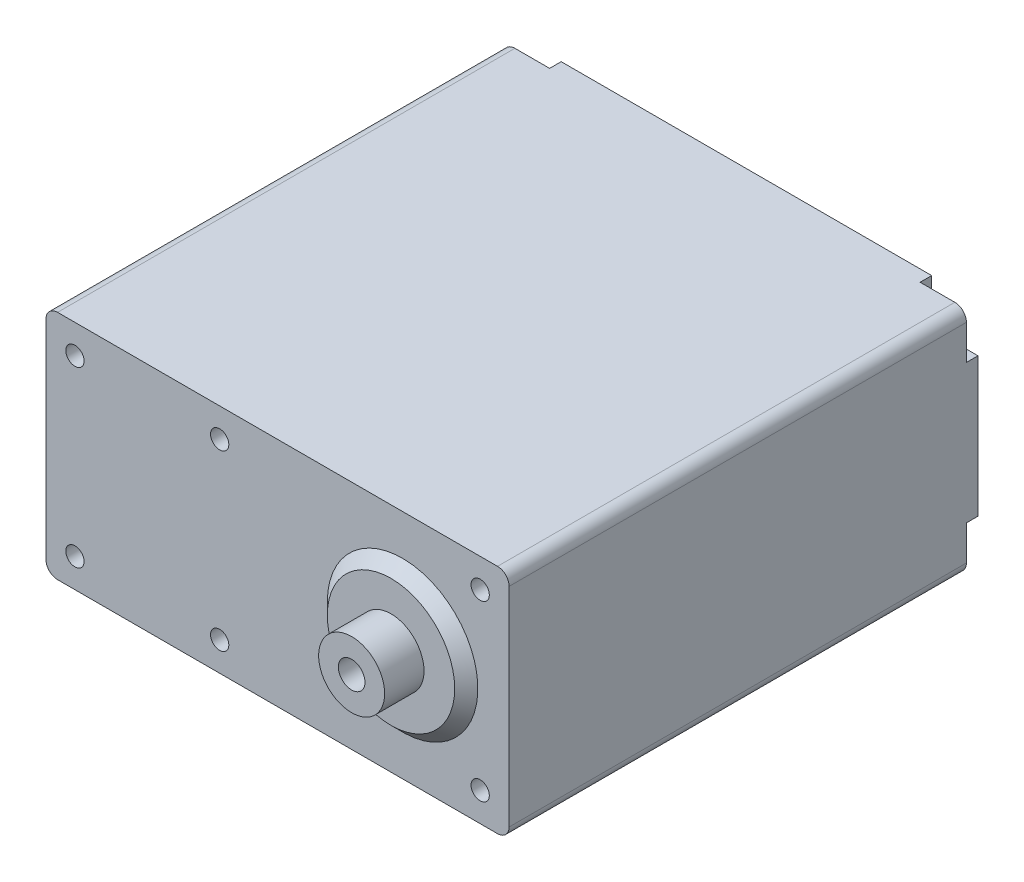
from build123d import *

# Parameters (mm, degrees)
ESQUISSE1_W             = 40
ESQUISSE1_H             = 20
BOSS_EXTRU_1_DEPTH      = 40.5
ESQUISSE2_R             = 0.79
ENL_V_MAT_EXTRU_2_DEPTH = 61.334484335
ENL_V_MAT_EXTRU_3_DEPTH = 1
ESQUISSE4_R             = 0.79
ENL_V_MAT_EXTRU_4_DEPTH = 20
ESQUISSE5_R             = 6.5
BOSS_EXTRU_2_DEPTH      = 1
CHANFREIN1_SIZE         = 1
ESQUISSE6_R             = 2.85
BOSS_EXTRU_3_DEPTH      = 3.4
CONG_1_R                = 1
BOSS_EXTRU_4_START      = 1
ESQUISSE7_R             = 6.5
BOSS_EXTRU_4_DEPTH      = 1
CHANFREIN2_SIZE         = 1
BOSS_EXTRU_5_START      = 3.4
ESQUISSE8_R             = 2.85
BOSS_EXTRU_5_DEPTH      = 3.4
ENL_V_MAT_EXTRU_6_DEPTH = 15
ESQUISSE10_R            = 0.79
ENL_V_MAT_EXTRU_7_DEPTH = 20
ESQUISSE11_R            = 1.15
ENL_V_MAT_EXTRU_8_DEPTH = 15
ENL_V_START             = -15
ESQUISSE12_R            = 1.15
ENL_V_MAT_EXTRU_9_DEPTH = 15


with BuildPart() as part:
    # Esquisse1 → Boss.-Extru.1 (new body)
    with BuildSketch(Plane.XY):
        with Locations((20, 10)):
            Rectangle(ESQUISSE1_W, ESQUISSE1_H)
    extrude(amount=BOSS_EXTRU_1_DEPTH)

    # Esquisse2 → Enlèv. mat.-Extru.2 (cut, through all)
    with BuildSketch(Plane(origin=(0, 0, 0), x_dir=(-1, 0, 0), z_dir=(0, 0, -1))):
        with Locations((-2.5, 2.5)):
            Circle(ESQUISSE2_R)
        with Locations((-37.5, 2.5)):
            Circle(ESQUISSE2_R)
        with Locations((-2.5, 17.5)):
            Circle(ESQUISSE2_R)
        with Locations((-37.5, 17.5)):
            Circle(ESQUISSE2_R)
    extrude(amount=-ENL_V_MAT_EXTRU_2_DEPTH, mode=Mode.SUBTRACT)

    # Esquisse3 → Enlèv. mat.-Extru.3 (cut)
    with BuildSketch(Plane(origin=(0, 0, 0), x_dir=(-1, 0, 0), z_dir=(0, 0, -1))):
        with BuildLine():
            Line((0, 16), (-3, 16))
            ThreePointArc((-3, 16), (-3.707106781, 16.292893219), (-4, 17))
            Line((-4, 17), (-4, 20))
            Line((-4, 20), (0, 20))
            Line((0, 20), (0, 16))
        make_face()
        with BuildLine():
            Line((0, 0), (-4, 0))
            Line((-4, 0), (-4, 3))
            ThreePointArc((-4, 3), (-3.707106781, 3.707106781), (-3, 4))
            Line((-3, 4), (0, 4))
            Line((0, 4), (0, 0))
        make_face()
        with BuildLine():
            Line((-36, 0), (-40, 0))
            Line((-40, 0), (-40, 4))
            Line((-40, 4), (-37, 4))
            ThreePointArc((-37, 4), (-36.292893219, 3.707106781), (-36, 3))
            Line((-36, 3), (-36, 0))
        make_face()
        with BuildLine():
            Line((-37, 16), (-40, 16))
            Line((-40, 16), (-40, 20))
            Line((-40, 20), (-36, 20))
            Line((-36, 20), (-36, 17))
            ThreePointArc((-36, 17), (-36.292893219, 16.292893219), (-37, 16))
        make_face()
    extrude(amount=-ENL_V_MAT_EXTRU_3_DEPTH, mode=Mode.SUBTRACT)

    # Esquisse4 → Enlèv. mat.-Extru.4 (cut)
    with BuildSketch(Plane(origin=(0, 0, 0), x_dir=(-1, 0, 0), z_dir=(0, 0, -1))):
        with Locations((-3, 10)):
            Circle(ESQUISSE4_R)
        with Locations((-10, 17)):
            Circle(ESQUISSE4_R)
        with Locations((-10, 3)):
            Circle(ESQUISSE4_R)
        with Locations((-17, 10)):
            Circle(ESQUISSE4_R)
        with Locations((-24, 2)):
            Circle(ESQUISSE4_R)
        with Locations((-24, 18)):
            Circle(ESQUISSE4_R)
    extrude(amount=-ENL_V_MAT_EXTRU_4_DEPTH, mode=Mode.SUBTRACT)

    # Esquisse5 → Boss.-Extru.2 (add)
    with BuildSketch(Plane(origin=(0, 0, 0), x_dir=(-1, 0, 0), z_dir=(0, 0, -1))):
        with Locations((-30.8, 10)):
            Circle(ESQUISSE5_R)
    extrude(amount=BOSS_EXTRU_2_DEPTH)

    # Chanfrein1
    chanfrein1_edges = [part.edges().sort_by_distance(p)[0] for p in [
        (37.3, 10, -1),
    ]]
    chamfer(chanfrein1_edges, length=CHANFREIN1_SIZE - 0.0001)  # a hair under: the kernel refuses the full size

    # Esquisse6 → Boss.-Extru.3 (add)
    with BuildSketch(Plane(origin=(0, 0, -1), x_dir=(-1, 0, 0), z_dir=(0, 0, -1))):
        with Locations((-30.8, 10)):
            Circle(ESQUISSE6_R)
    extrude(amount=BOSS_EXTRU_3_DEPTH)

    # Congé1
    cong_1_edges = [part.edges().sort_by_distance(p)[0] for p in [
        (0, 20, 20.75),
        (40, 20, 20.75),
        (40, 0, 20.75),
        (0, 0, 20.75),
    ]]
    fillet(cong_1_edges, radius=CONG_1_R)

    # Esquisse7 → Boss.-Extru.4 (add)
    with BuildSketch(Plane.XY.offset(40.5).offset(BOSS_EXTRU_4_START)):
        with Locations(Location((30.8, 10, 0), (0, 0, 180))):
            Circle(ESQUISSE7_R)
    extrude(amount=-BOSS_EXTRU_4_DEPTH)

    # Chanfrein2
    chanfrein2_edges = [part.edges().sort_by_distance(p)[0] for p in [
        (37.3, 10, 41.5),
    ]]
    chamfer(chanfrein2_edges, length=CHANFREIN2_SIZE - 0.0001)  # a hair under: the kernel refuses the full size

    # Esquisse8 → Boss.-Extru.5 (add)
    with BuildSketch(Plane.XY.offset(41.5).offset(BOSS_EXTRU_5_START)):
        with Locations(Location((30.8, 10, 0), (0, 0, 180))):
            Circle(ESQUISSE8_R)
    extrude(amount=-BOSS_EXTRU_5_DEPTH)

    # Esquisse9 → Enlèv. mat.-Extru.6 (cut)
    with BuildSketch(Plane.XZ):
        with BuildLine():
            Line((30.852193658, 30.389388186), (25.852193658, 30.389388186))
            ThreePointArc((25.852193658, 30.389388186), (25.145086877, 30.682281405), (24.852193658, 31.389388186))
            Line((24.852193658, 31.389388186), (24.852193658, 33.389388186))
            ThreePointArc((24.852193658, 33.389388186), (25.145086877, 34.096494967), (25.852193658, 34.389388186))
            Line((25.852193658, 34.389388186), (30.852193658, 34.389388186))
            ThreePointArc((30.852193658, 34.389388186), (31.559300439, 34.096494967), (31.852193658, 33.389388186))
            Line((31.852193658, 33.389388186), (31.852193658, 31.389388186))
            ThreePointArc((31.852193658, 31.389388186), (31.559300439, 30.682281405), (30.852193658, 30.389388186))
        make_face()
    extrude(amount=-ENL_V_MAT_EXTRU_6_DEPTH, mode=Mode.SUBTRACT)

    # Esquisse10 → Enlèv. mat.-Extru.7 (cut)
    with BuildSketch(Plane.XY.offset(40.5)):
        with Locations((15, 2.5)):
            Circle(ESQUISSE10_R)
        with Locations((15, 17.5)):
            Circle(ESQUISSE10_R)
    extrude(amount=-ENL_V_MAT_EXTRU_7_DEPTH, mode=Mode.SUBTRACT)

    # Esquisse11 → Enlèv. mat.-Extru.8 (cut)
    with BuildSketch(Plane.XY.offset(44.9)):
        with Locations((30.8, 10)):
            Circle(ESQUISSE11_R)
    extrude(amount=-ENL_V_MAT_EXTRU_8_DEPTH, mode=Mode.SUBTRACT)

    # Esquisse12 → Enlèv. mat.-Extru.9 (cut)
    with BuildSketch(Plane(origin=(0, 0, -4.4), x_dir=(-1, 0, 0), z_dir=(0, 0, -1)).offset(ENL_V_START)):
        with Locations(Location((-30.8, 10, 0), (0, 0, 180))):
            Circle(ESQUISSE12_R)
    extrude(amount=ENL_V_MAT_EXTRU_9_DEPTH, mode=Mode.SUBTRACT)


solid = part.part
